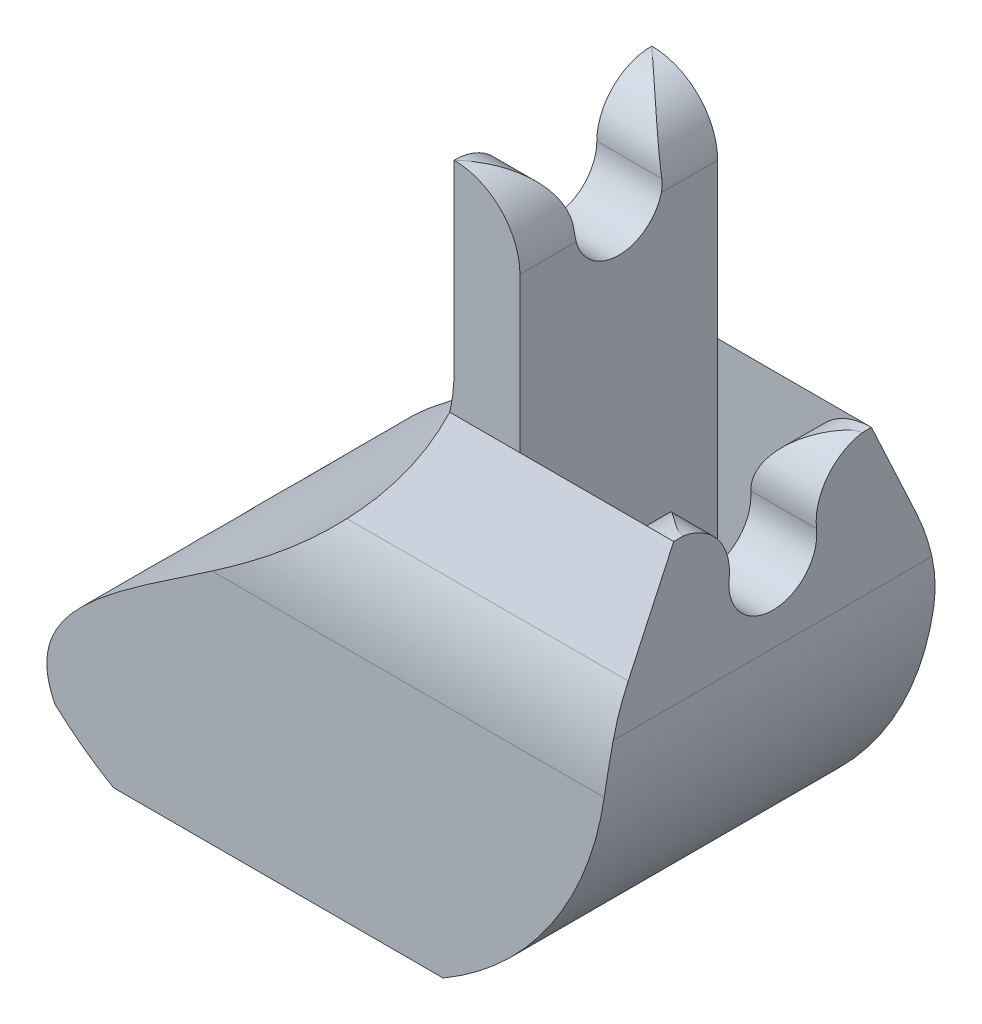
from build123d import *

# Parameters (mm, degrees)
SKETCH1_R                = 2
SKETCH1_R_2              = 2.6
BOSS_EXTRUDE1_DEPTH      = 9
FILLET1_R                = 4
SKETCH3_W                = 1
SKETCH3_H                = 25
CUT_EXTRUDE2_DEPTH       = 131.694299799
CUT_EXTRUDE3_DEPTH       = 132.837020597
BOSS_EXTRUDE2_DEPTH      = 3
BOSS_EXTRUDE4_DEPTH      = 5
CUT_EXTRUDE4_DEPTH       = 2
FILLET2_R                = 20
FILLET3_R                = 4
BOSS_EXTRUDE5_DEPTH      = 12
BOSS_EXTRUDE5_DEPTH_BACK = 3
CUT_EXTRUDE5_DEPTH       = 134.026557597
CUT_EXTRUDE5_DEPTH_BACK  = 134.026557597


with BuildPart() as part:
    # Sketch1 → Boss-Extrude1 (new body)
    with BuildSketch(Plane.XY):
        Polygon((0, 0), (-10, 0), (-10, 30), (-20, 90), (-20, 130), (-10, 130), (-10, 90), (0, 30), align=None)
        with Locations((-15, 100)):
            Circle(SKETCH1_R, mode=Mode.SUBTRACT)
        with Locations((-15, 125)):
            Circle(SKETCH1_R_2, mode=Mode.SUBTRACT)
    extrude(amount=BOSS_EXTRUDE1_DEPTH)

    # Fillet1
    fillet1_edges = [part.edges().sort_by_distance(p)[0] for p in [
        (0, 0, 4.5),
        (-10, 0, 4.5),
    ]]
    fillet(fillet1_edges, radius=FILLET1_R)

    # Sketch3 → Cut-Extrude2 (cut, through all)
    with BuildSketch(Plane.ZY.offset(10)):
        with Locations((0.5, 117.5)):
            Rectangle(SKETCH3_W, SKETCH3_H)
    extrude(amount=CUT_EXTRUDE2_DEPTH, mode=Mode.SUBTRACT)

    # Sketch5 → Cut-Extrude3 (cut, through all)
    with BuildSketch(Plane.XY.offset(9)):
        with BuildLine():
            Line((-10, 4), (-10, 24))
            ThreePointArc((-10, 24), (-7.878679656, 23.121320344), (-7, 21))
            Line((-7, 21), (-7, 6))
            ThreePointArc((-7, 6), (-5, 4), (-3, 6))
            Line((-3, 6), (-3, 10.96659189))
            ThreePointArc((-3, 10.96659189), (-2.121320344, 13.087912234), (0, 13.96659189))
            Line((0, 13.96659189), (0, 4))
            ThreePointArc((0, 4), (-1.171572875, 1.171572875), (-4, 0))
            Line((-4, 0), (-6, 0))
            ThreePointArc((-6, 0), (-8.828427125, 1.171572875), (-10, 4))
        make_face()
    extrude(amount=-CUT_EXTRUDE3_DEPTH, mode=Mode.SUBTRACT)

    # Boss-Extrude2: read off the stored shape, not the designer's step
    # Boss-Extrude2 outline → Boss-Extrude2 (add)
    with BuildSketch(Plane.ZY):
        with BuildLine():
            Line((9, 13.96659189), (9, 30))
            Line((9, 30), (0, 30))
            Line((0, 30), (0, 13.96659189))
            Line((0, 13.96659189), (0.423395215, 13.96659189))
            ThreePointArc((0.423395215, 13.96659189), (2.009052541, 13.008624555), (2.499994655, 11.222291324))
            ThreePointArc((2.499994655, 11.222291324), (4.487608253, 9.000047793), (6.47522185, 11.222291324))
            ThreePointArc((6.47522185, 11.222291324), (6.966163965, 13.008624555), (8.551821291, 13.96659189))
            Line((8.551821291, 13.96659189), (9, 13.96659189))
        make_face()
    extrude(amount=BOSS_EXTRUDE2_DEPTH)

    # Sketch8 → Boss-Extrude4 (add)
    with BuildSketch(Plane.ZY.offset(10)):
        with BuildLine():
            Line((2.5, 21.5), (6.5, 21.5))
            ThreePointArc((6.5, 21.5), (4.5, 19.5), (2.5, 21.5))
        make_face()
        with BuildLine():
            ThreePointArc((0, 24), (1.767766953, 23.267766953), (2.5, 21.5))
            Line((2.5, 21.5), (6.5, 21.5))
            ThreePointArc((6.5, 21.5), (7.232233047, 23.267766953), (9, 24))
            Line((9, 24), (0, 24))
        make_face()
    extrude(amount=-BOSS_EXTRUDE4_DEPTH)

    # Sketch9 → Cut-Extrude4 (cut)
    with BuildSketch(Plane(origin=(4.931969619, 0.408182285, 0), x_dir=(0, 0, -1), z_dir=(0.9863939238321437, 0.16439898730535749, 0))):
        with BuildLine():
            Line((-7, 37), (-7, 85.827625303))
            ThreePointArc((-7, 85.827625303), (-4.5, 88.327625303), (-2, 85.827625303))
            Line((-2, 85.827625303), (-2, 37))
            ThreePointArc((-2, 37), (-4.5, 34.5), (-7, 37))
        make_face()
    cut_extrude4 = extrude(amount=-CUT_EXTRUDE4_DEPTH, mode=Mode.SUBTRACT)

    # Mirror1: Cut-Extrude4 across plane
    add(cut_extrude4.mirror(Plane(origin=(0, 0, 0), x_dir=(0, 0, 1), z_dir=(0.9863939238321437, 0.16439898730535743, 0))), mode=Mode.SUBTRACT)

    # Fillet2
    fillet2_edges = [part.edges().sort_by_distance(p)[0] for p in [
        (-10, 30, 4.5),
        (-20, 90, 4.5),
        (-10, 90, 4.5),
        (0, 30, 4.5),
    ]]
    fillet(fillet2_edges, radius=FILLET2_R)

    # Fillet3
    fillet3_edges = [part.edges().sort_by_distance(p)[0] for p in [
        (-20, 130, 5),
        (-10, 130, 5),
    ]]
    fillet(fillet3_edges, radius=FILLET3_R)


with BuildPart() as body_2:
    # Sketch1<5> → Boss-Extrude5 (new, two sides: drawn at the far end of the back side and taken through both)
    with BuildSketch(Plane.XY.offset(-BOSS_EXTRUDE5_DEPTH_BACK)):
        with BuildLine():
            ThreePointArc((-25.154949118, -3.539792045), (-8.971908958, -6.235432952), (0, 7.5))
            Line((0, 7.5), (0, 27.350317066))
            Line((0, 27.350317066), (-10, 27.350317066))
            Line((-10, 27.350317066), (-10, 15.414300315))
            add(Edge.make_bspline(
                [(-10, 15.414300315), (-10.3332076, 5.995566791), (-28.355100317, 2.568910038), (-25.154949118, -3.539792045)],
                knots=[0, 0, 0, 0, 0.764316477, 0.764316477, 0.764316477, 0.764316477], degree=3))
        make_face()
    extrude(amount=BOSS_EXTRUDE5_DEPTH + BOSS_EXTRUDE5_DEPTH_BACK)

    # Sketch10 → Cut-Extrude5 (cut, two sides: drawn at the far end of the back side and taken through both)
    with BuildSketch(Plane(origin=(0, 0, 0), x_dir=(0, 0, -1), z_dir=(1, 0, 0)).offset(-CUT_EXTRUDE5_DEPTH_BACK)):
        with BuildLine():
            Line((-9, 13.96659189), (-9, 28.344749394))
            Line((-9, 28.344749394), (-14.199341922, 29.234870168))
            Line((-14.199341922, 29.234870168), (-18.34923463, 5.372987094))
            Line((-18.34923463, 5.372987094), (-14.775715909, -10.880759347))
            Line((-14.775715909, -10.880759347), (12.313861494, -10.073835765))
            Line((12.313861494, -10.073835765), (10.584739532, 28.344749394))
            Line((10.584739532, 28.344749394), (0, 28.344749394))
            Line((0, 28.344749394), (0, 13.96659189))
            Line((0, 13.96659189), (2.071346392, 9.501741297))
            ThreePointArc((2.071346392, 9.501741297), (2.765077161, 7.448160424), (3, 5.29333606))
            Line((3, 5.29333606), (3, -5.490381057))
            ThreePointArc((3, -5.490381057), (-4.5, -7.5), (-12, -5.490381057))
            Line((-12, -5.490381057), (-12, 5.29333606))
            ThreePointArc((-12, 5.29333606), (-11.765077161, 7.448160424), (-11.071346392, 9.501741297))
            Line((-11.071346392, 9.501741297), (-9, 13.96659189))
        make_face()
    extrude(amount=CUT_EXTRUDE5_DEPTH + CUT_EXTRUDE5_DEPTH_BACK, mode=Mode.SUBTRACT)

    # Combine1: cut part
    add(part.part, mode=Mode.SUBTRACT)


solid = body_2.part
